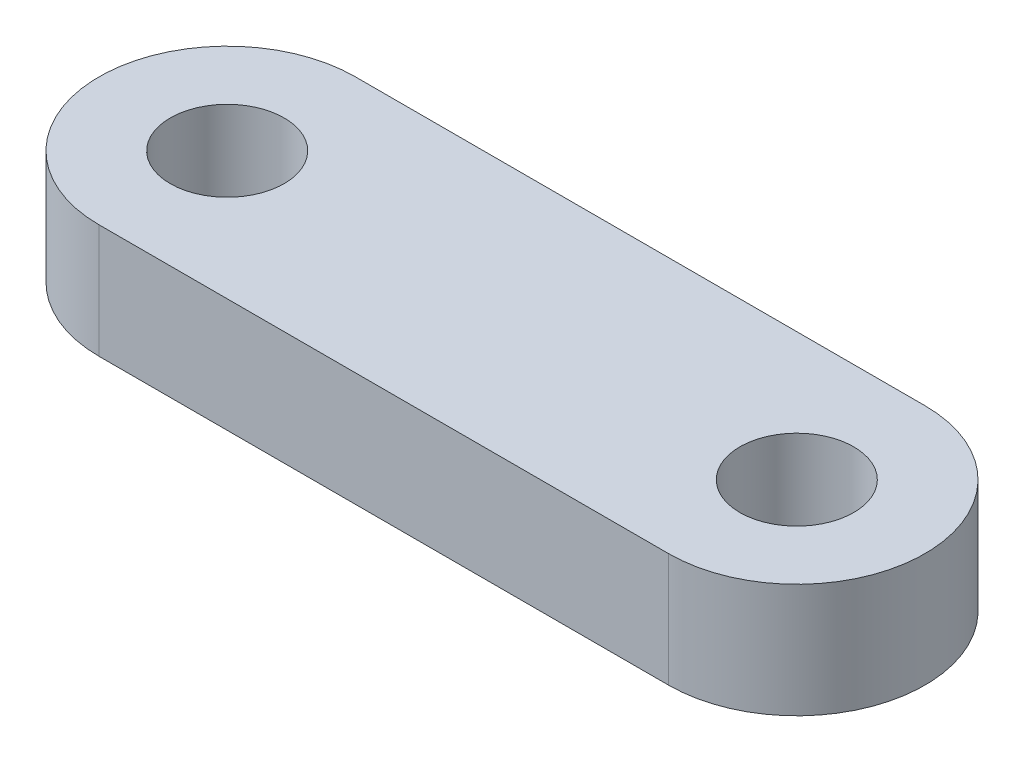
from build123d import *

# Parameters (mm, degrees)
SKETCH_1_R      = 2
EXTRUDE_1_DEPTH = 4


with BuildPart() as part:
    # Эскиз1 → Вытянуть1 (new body)
    with BuildSketch(Plane(origin=(0, 0, 0), x_dir=(1, 0, 0), z_dir=(0, 1, 0))):
        with BuildLine():
            Line((0, 4.5), (20, 4.5))
            ThreePointArc((20, 4.5), (24.5, 0), (20, -4.5))
            Line((20, -4.5), (0, -4.5))
            ThreePointArc((0, -4.5), (-4.5, 0), (0, 4.5))
        make_face()
        Circle(SKETCH_1_R, mode=Mode.SUBTRACT)
        with Locations((20, 0)):
            Circle(SKETCH_1_R, mode=Mode.SUBTRACT)
    extrude(amount=EXTRUDE_1_DEPTH)


solid = part.part
